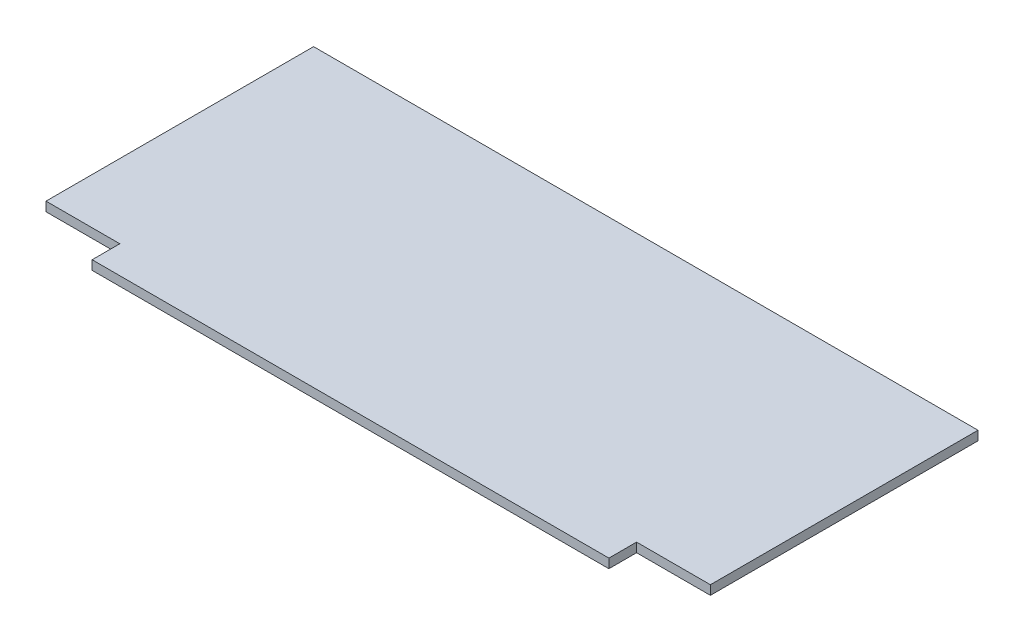
from build123d import *

# Parameters (mm, degrees)
SKETCH1_W           = 457.2
SKETCH1_H           = 203.2
BOSS_EXTRUDE1_DEPTH = 6.35
SKETCH2_W           = 50.8
SKETCH2_H           = 19.05
CUT_EXTRUDE1_DEPTH  = 251.24156829


with BuildPart() as part:
    # Sketch1 → Boss-Extrude1 (new body)
    with BuildSketch(Plane(origin=(0, 0, 0), x_dir=(1, 0, 0), z_dir=(0, 1, 0))):
        Rectangle(SKETCH1_W, SKETCH1_H)
    extrude(amount=BOSS_EXTRUDE1_DEPTH)

    # Sketch2 → Cut-Extrude1 (cut, through all)
    with BuildSketch(Plane(origin=(0, 6.35, 0), x_dir=(1, 0, 0), z_dir=(0, 1, 0))):
        with Locations((-203.2, -92.075)):
            Rectangle(SKETCH2_W, SKETCH2_H)
        with Locations((203.2, -92.075)):
            Rectangle(SKETCH2_W, SKETCH2_H)
    extrude(amount=-CUT_EXTRUDE1_DEPTH, mode=Mode.SUBTRACT)


solid = part.part
